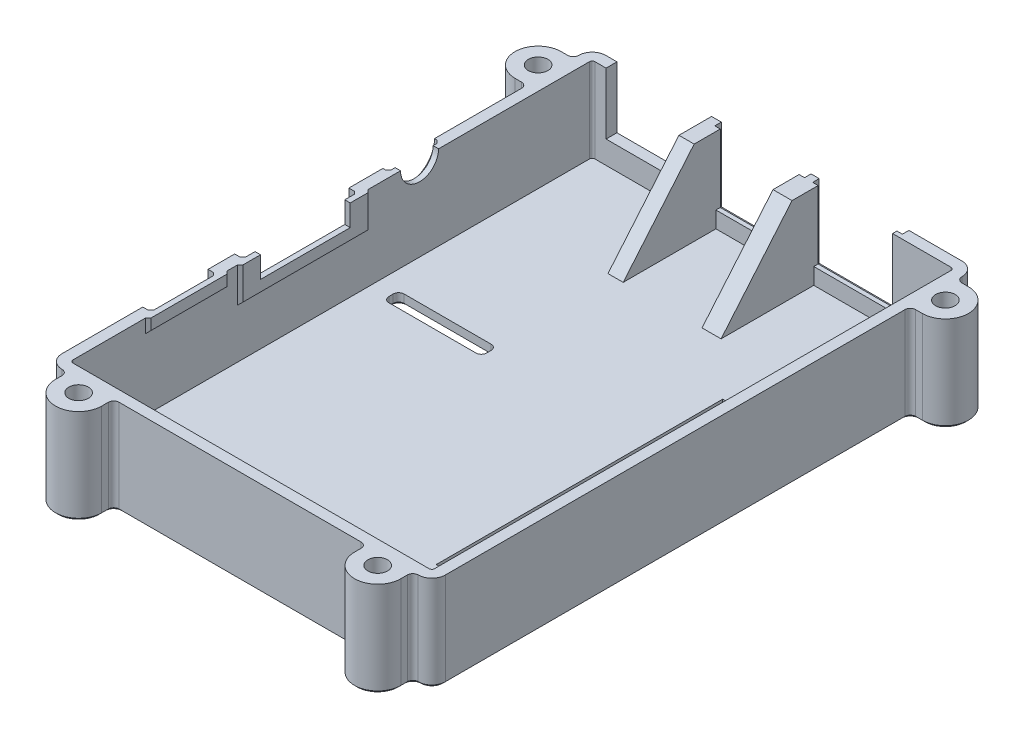
from build123d import *

# Parameters (mm, degrees)
BASE_DEPTH                      = 17.5
SHELL_T                         = -2
CLAMPS_DEPTH                    = 17.5
CLAMP_FILLETS_R                 = 1
SKETCH20_R                      = 1.8
CLAMP_HOLES_DEPTH               = 128.387411073
SKETCH21_R                      = 2.9
CLAMP_COUNTERSINKS_DEPTH        = 3.4
CLAMP_COUNTERSINK_CHAMFERS_SIZE = 0.3
SKETCH24_W                      = 14.5
SKETCH24_H                      = 12.5
USB_CUTOUT_DEPTH                = 18.25
SKETCH25_W                      = 16.5
SKETCH25_H                      = 13.5
USB_APPROACH_DEPTH              = 1.2
USB_INNER_SUPPORT_DEPTH         = 3.5
USB_OUTER_SUPPORT_DEPTH         = 2.8
SKETCH28_W                      = 17.4
SKETCH28_H                      = 11.3
RJ45_CUTOUT_DEPTH               = 22.7
SKETCH29_W                      = 15
SKETCH29_H                      = 2.5
SKETCH29_W_2                    = 24
SKETCH29_H_2                    = 6.43
HDMI_SUPPORT_DEPTH              = 0.5
HDMI_SUPPORT_CHAMFER_SIZE       = 0.5
SKETCH30_W                      = 21
SKETCH30_H                      = 5.93
SKETCH30_W_2                    = 12
SKETCH30_H_2                    = 2
HDMI_APPROACH_DEPTH             = 1.5
SKETCH31_W                      = 16.5
SKETCH31_H                      = 3.93
HDMI_CUTOUT_DEPTH               = 1
HDMI_APPROACH_CHAMFER_SIZE      = 0.5
SKETCH32_R                      = 3.5
AUDIO_CUTOUT_DEPTH              = 2
SKETCH33_R                      = 4.75
AUDIO_APPROACH_DEPTH            = 1
AUDIO_APPROACH_CHAMFER_SIZE     = 0.5
SKETCH34_W                      = 6
SKETCH34_H                      = 52.7
HEADER_CUTOUT_DEPTH             = 2
HEADER_COVER_DEPTH              = 1
SHELL_CHAMFER_SIZE              = 0.5
RIBBON_SLOT_DEPTH               = 2
RIBBON_SLOT_CHAMFER_SIZE        = 0.5


with BuildPart() as part:
    # Sketch2 → Base (new body)
    with BuildSketch(Plane(origin=(0, 0, 0), x_dir=(1, 0, 0), z_dir=(0, 1, 0))):
        with BuildLine():
            Line((2.5, 0), (68, 0))
            ThreePointArc((68, 0), (69.767766953, 0.732233047), (70.5, 2.5))
            Line((70.5, 2.5), (70.5, 97.5))
            ThreePointArc((70.5, 97.5), (69.767766953, 99.267766953), (68, 100))
            Line((68, 100), (2.5, 100))
            ThreePointArc((2.5, 100), (0.732233047, 99.267766953), (0, 97.5))
            Line((0, 97.5), (0, 2.5))
            ThreePointArc((0, 2.5), (0.732233047, 0.732233047), (2.5, 0))
        make_face()
    extrude(amount=BASE_DEPTH)

    # Shell
    shell_openings = [part.faces().sort_by_distance(p)[0] for p in [
        (35.25, 17.5, -50),
    ]]
    offset(amount=SHELL_T, openings=shell_openings, kind=Kind.INTERSECTION)

    # Sketch14 → Clamps (add)
    with BuildSketch(Plane.XZ):
        with BuildLine():
            Line((-2.2, -88), (0, -88))
            Line((0, -88), (0, -96.5))
            Line((0, -96.5), (-2.2, -96.5))
            ThreePointArc((-2.2, -96.5), (-6.45, -92.25), (-2.2, -88))
        make_face()
        with BuildLine():
            Line((3.5, 2.2), (3.5, 0))
            Line((3.5, 0), (12, 0))
            Line((12, 0), (12, 2.2))
            ThreePointArc((12, 2.2), (7.75, 6.45), (3.5, 2.2))
        make_face()
        with BuildLine():
            Line((72.7, -88), (70.5, -88))
            Line((70.5, -88), (70.5, -96.5))
            Line((70.5, -96.5), (72.7, -96.5))
            ThreePointArc((72.7, -96.5), (76.95, -92.25), (72.7, -88))
        make_face()
        with BuildLine():
            Line((58.5, 0), (58.5, 2.2))
            ThreePointArc((58.5, 2.2), (62.75, 6.45), (67, 2.2))
            Line((67, 2.2), (67, 0))
            Line((67, 0), (58.5, 0))
        make_face()
    extrude(amount=-CLAMPS_DEPTH)

    # Clamp Fillets
    clamp_fillets_edges = [part.edges().sort_by_distance(p)[0] for p in [
        (0, 8.75, -96.5),
        (0, 8.75, -88),
        (3.5, 8.75, 0),
        (12, 8.75, 0),
        (70.5, 8.75, -88),
        (70.5, 8.75, -96.5),
        (58.5, 8.75, 0),
        (67, 8.75, 0),
    ]]
    fillet(clamp_fillets_edges, radius=CLAMP_FILLETS_R - 0.0001)  # a hair under: the kernel refuses the full size

    # Sketch20 → Clamp Holes (cut, through all)
    with BuildSketch(Plane.XZ):
        with Locations(Location((7.75, 2.2, 0), (0, 0, 270))):
            Circle(SKETCH20_R)
        with Locations(Location((62.75, 2.2, 0), (0, 0, 270))):
            Circle(SKETCH20_R)
        with Locations(Location((72.7, -92.25, 0), (0, 0, 270))):
            Circle(SKETCH20_R)
        with Locations(Location((-2.2, -92.25, 0), (0, 0, 270))):
            Circle(SKETCH20_R)
    extrude(amount=-CLAMP_HOLES_DEPTH, mode=Mode.SUBTRACT)

    # Sketch21 → Clamp Countersinks (cut)
    with BuildSketch(Plane.XZ):
        with Locations(Location((7.75, 2.2, 0), (0, 0, 270))):
            Circle(SKETCH21_R)
        with Locations(Location((62.75, 2.2, 0), (0, 0, 270))):
            Circle(SKETCH21_R)
        with Locations(Location((72.7, -92.25, 0), (0, 0, 270))):
            Circle(SKETCH21_R)
        with Locations(Location((-2.2, -92.25, 0), (0, 0, 270))):
            Circle(SKETCH21_R)
    extrude(amount=-CLAMP_COUNTERSINKS_DEPTH, mode=Mode.SUBTRACT)

    # Clamp Countersink Chamfers
    clamp_countersink_chamfers_edges = [part.edges().sort_by_distance(p)[0] for p in [
        (-2.2, 0, -89.35),
        (72.7, 0, -89.35),
        (62.75, 0, 5.1),
        (7.75, 0, 5.1),
    ]]
    chamfer(clamp_countersink_chamfers_edges, length=CLAMP_COUNTERSINK_CHAMFERS_SIZE)

    # Sketch24 → USB Cutout (cut)
    with BuildSketch(Plane(origin=(0, 0, -100), x_dir=(-1, 0, 0), z_dir=(0, 0, -1))):
        with Locations((-50, 11.25)):
            Rectangle(SKETCH24_W, SKETCH24_H)
        with Locations((-32, 11.25)):
            Rectangle(SKETCH24_W, SKETCH24_H)
    extrude(amount=-USB_CUTOUT_DEPTH, mode=Mode.SUBTRACT)

    # Sketch25 → USB Approach (cut)
    with BuildSketch(Plane(origin=(0, 0, -100), x_dir=(-1, 0, 0), z_dir=(0, 0, -1))):
        with Locations((-50, 10.75)):
            Rectangle(SKETCH25_W, SKETCH25_H)
        with Locations((-32, 10.75)):
            Rectangle(SKETCH25_W, SKETCH25_H)
    extrude(amount=-USB_APPROACH_DEPTH, mode=Mode.SUBTRACT)

    # Sketch26 → USB Inner Support (add)
    with BuildSketch(Plane(origin=(42.75, 0, 0), x_dir=(0, 0, -1), z_dir=(1, 0, 0))):
        Polygon((98, 2), (98, 17.5), (94, 17.5), (80.95, 2), align=None)
    extrude(amount=-USB_INNER_SUPPORT_DEPTH)

    # Sketch27 → USB Outer Support (add)
    with BuildSketch(Plane(origin=(24.75, 0, 0), x_dir=(0, 0, -1), z_dir=(1, 0, 0))):
        Polygon((98, 2), (98, 17.5), (94, 17.5), (80.95, 2), align=None)
    extrude(amount=-USB_OUTER_SUPPORT_DEPTH)

    # Sketch28 → RJ45 Cutout (cut)
    with BuildSketch(Plane(origin=(0, 0, -100), x_dir=(-1, 0, 0), z_dir=(0, 0, -1))):
        with Locations((-13.25, 11.85)):
            Rectangle(SKETCH28_W, SKETCH28_H)
    extrude(amount=-RJ45_CUTOUT_DEPTH, mode=Mode.SUBTRACT)

    # Sketch29 → HDMI Support (add)
    with BuildSketch(Plane(origin=(2, 0, 0), x_dir=(0, 0, -1), z_dir=(1, 0, 0))):
        with Locations((23.35, 16.25)):
            Rectangle(SKETCH29_W, SKETCH29_H)
        with Locations((44.75, 14.285)):
            Rectangle(SKETCH29_W_2, SKETCH29_H_2)
    extrude(amount=HDMI_SUPPORT_DEPTH)

    # HDMI Support Chamfer
    hdmi_support_chamfer_edges = [part.edges().sort_by_distance(p)[0] for p in [
        (2.5, 14.285, -56.75),
        (2.5, 11.07, -44.75),
        (2.5, 14.285, -32.75),
        (2.5, 16.25, -30.85),
        (2.5, 15, -23.35),
        (2.5, 16.25, -15.85),
    ]]
    chamfer(hdmi_support_chamfer_edges, length=HDMI_SUPPORT_CHAMFER_SIZE - 0.0001)  # a hair under: the kernel refuses the full size

    # Sketch30 → HDMI Approach (cut)
    with BuildSketch(Plane.ZY):
        with Locations((-44.75, 14.535)):
            Rectangle(SKETCH30_W, SKETCH30_H)
        with Locations((-23.35, 16.5)):
            Rectangle(SKETCH30_W_2, SKETCH30_H_2)
    extrude(amount=-HDMI_APPROACH_DEPTH, mode=Mode.SUBTRACT)

    # Sketch31 → HDMI Cutout (cut)
    with BuildSketch(Plane.ZY.offset(-1.5)):
        with Locations((-44.75, 15.535)):
            Rectangle(SKETCH31_W, SKETCH31_H)
    extrude(amount=-HDMI_CUTOUT_DEPTH, mode=Mode.SUBTRACT)

    # HDMI Approach Chamfer
    hdmi_approach_chamfer_edges = [part.edges().sort_by_distance(p)[0] for p in [
        (1.5, 14.535, -34.25),
        (1.5, 11.57, -44.75),
        (1.5, 14.535, -55.25),
        (1.5, 16.5, -29.35),
        (1.5, 16.5, -17.35),
        (1.5, 15.5, -23.35),
    ]]
    chamfer(hdmi_approach_chamfer_edges, length=HDMI_APPROACH_CHAMFER_SIZE)

    # Sketch32 → Audio Cutout (cut)
    with BuildSketch(Plane.ZY):
        with Locations((-66.25, 17.5)):
            Circle(SKETCH32_R)
    extrude(amount=-AUDIO_CUTOUT_DEPTH, mode=Mode.SUBTRACT)

    # Sketch33 → Audio Approach (cut)
    with BuildSketch(Plane.ZY):
        with Locations((-66.25, 17.5)):
            Circle(SKETCH33_R)
    extrude(amount=-AUDIO_APPROACH_DEPTH, mode=Mode.SUBTRACT)

    # Audio Approach Chamfer
    audio_approach_chamfer_edges = [part.edges().sort_by_distance(p)[0] for p in [
        (1, 12.75, -66.25),
    ]]
    chamfer(audio_approach_chamfer_edges, length=AUDIO_APPROACH_CHAMFER_SIZE)

    # Sketch34 → Header Cutout (cut)
    with BuildSketch(Plane.XZ):
        with Locations((55.5, -45.15)):
            Rectangle(SKETCH34_W, SKETCH34_H)
    extrude(amount=-HEADER_CUTOUT_DEPTH, mode=Mode.SUBTRACT)

    # Sketch35 → Header Cover (add)
    with BuildSketch(Plane.XZ):
        Polygon((56, -18.8), (55, -18.8), (55, -19.8), (53.5, -19.8), (53.5, -24.7625), (52.5, -24.7625), (52.5, -25.7625), (53.5, -25.7625), (53.5, -37.6875), (52.5, -37.6875), (52.5, -38.6875), (53.5, -38.6875), (53.5, -43.65), (55, -43.65), (55, -44.65), (52.5, -44.65), (52.5, -45.65), (55, -45.65), (55, -46.65), (53.5, -46.65), (53.5, -51.6125), (52.5, -51.6125), (52.5, -52.6125), (53.5, -52.6125), (53.5, -64.5375), (52.5, -64.5375), (52.5, -65.5375), (53.5, -65.5375), (53.5, -70.5), (55, -70.5), (55, -71.5), (56, -71.5), (56, -70.5), (57.5, -70.5), (57.5, -65.5375), (58.5, -65.5375), (58.5, -64.5375), (57.5, -64.5375), (57.5, -52.6125), (58.5, -52.6125), (58.5, -51.6125), (57.5, -51.6125), (57.5, -46.65), (56, -46.65), (56, -45.65), (58.5, -45.65), (58.5, -44.65), (56, -44.65), (56, -43.65), (57.5, -43.65), (57.5, -38.6875), (58.5, -38.6875), (58.5, -37.6875), (57.5, -37.6875), (57.5, -25.7625), (58.5, -25.7625), (58.5, -24.7625), (57.5, -24.7625), (57.5, -19.8), (56, -19.8), align=None)
    extrude(amount=-HEADER_COVER_DEPTH)

    # Shell Chamfer
    shell_chamfer_edges = [part.edges().sort_by_distance(p)[0] for p in [
        (-1.59995, 0, -88),
        (72.09995, 0, -96.5),
        (58.207136071, 0, 0.292863929),
        (0.732233047, 0, -0.732233047),
        (67.292863929, 0, 0.292863929),
        (12.292863929, 0, 0.292863929),
        (3.207136071, 0, 0.292863929),
        (-0.292863929, 0, -96.792863929),
        (-0.292863929, 0, -87.707136071),
        (70.792863929, 0, -87.707136071),
        (70.792863929, 0, -96.792863929),
        (-6.45, 0, -92.25),
        (-1.59995, 0, -96.5),
        (52.5, 0, -21.78125),
        (53.75, 0, -71.5),
        (58.5, 0, -68.51875),
        (57.25, 0, -18.8),
        (57.25, 0, -71.5),
        (58.5, 0, -58.575),
        (58.5, 0, -48.63125),
        (58.5, 0, -41.66875),
        (58.5, 0, -31.725),
        (58.5, 0, -21.78125),
        (53.75, 0, -18.8),
        (52.5, 0, -31.725),
        (52.5, 0, -41.66875),
        (52.5, 0, -48.63125),
        (52.5, 0, -58.575),
        (52.5, 0, -68.51875),
        (7.75, 0, 6.45),
        (3.5, 0, 1.59995),
        (76.95, 0, -92.25),
        (72.09995, 0, -88),
        (62.75, 0, 6.45),
        (58.5, 0, 1.59995),
        (0.732233047, 0, -99.267766953),
        (35.25, 0, -100),
        (69.767766953, 0, -99.267766953),
        (35.25, 0, 0),
        (70.5, 0, -44.75005),
        (67, 0, 1.59995),
        (12, 0, 1.59995),
        (69.767766953, 0, -0.732233047),
        (0, 0, -44.75005),
    ]]
    chamfer(shell_chamfer_edges, length=SHELL_CHAMFER_SIZE)

    # Sketch38 → Ribbon Slot (cut)
    with BuildSketch(Plane.XZ):
        with BuildLine():
            Line((6.45, -56.157), (22.45, -56.157))
            ThreePointArc((22.45, -56.157), (23.157106781, -56.449893219), (23.45, -57.157))
            Line((23.45, -57.157), (23.45, -57.957))
            ThreePointArc((23.45, -57.957), (23.157106781, -58.664106781), (22.45, -58.957))
            Line((22.45, -58.957), (6.45, -58.957))
            ThreePointArc((6.45, -58.957), (5.742893219, -58.664106781), (5.45, -57.957))
            Line((5.45, -57.957), (5.45, -57.157))
            ThreePointArc((5.45, -57.157), (5.742893219, -56.449893219), (6.45, -56.157))
        make_face()
    extrude(amount=-RIBBON_SLOT_DEPTH, mode=Mode.SUBTRACT)

    # Ribbon Slot Chamfer
    ribbon_slot_chamfer_edges = [part.edges().sort_by_distance(p)[0] for p in [
        (23.157106781, 0, -56.449893219),
        (14.45, 0, -56.157),
        (5.742893219, 0, -56.449893219),
        (5.45, 0, -57.557),
        (5.742893219, 0, -58.664106781),
        (14.45, 0, -58.957),
        (23.157106781, 0, -58.664106781),
        (23.45, 0, -57.557),
    ]]
    chamfer(ribbon_slot_chamfer_edges, length=RIBBON_SLOT_CHAMFER_SIZE)


solid = part.part
